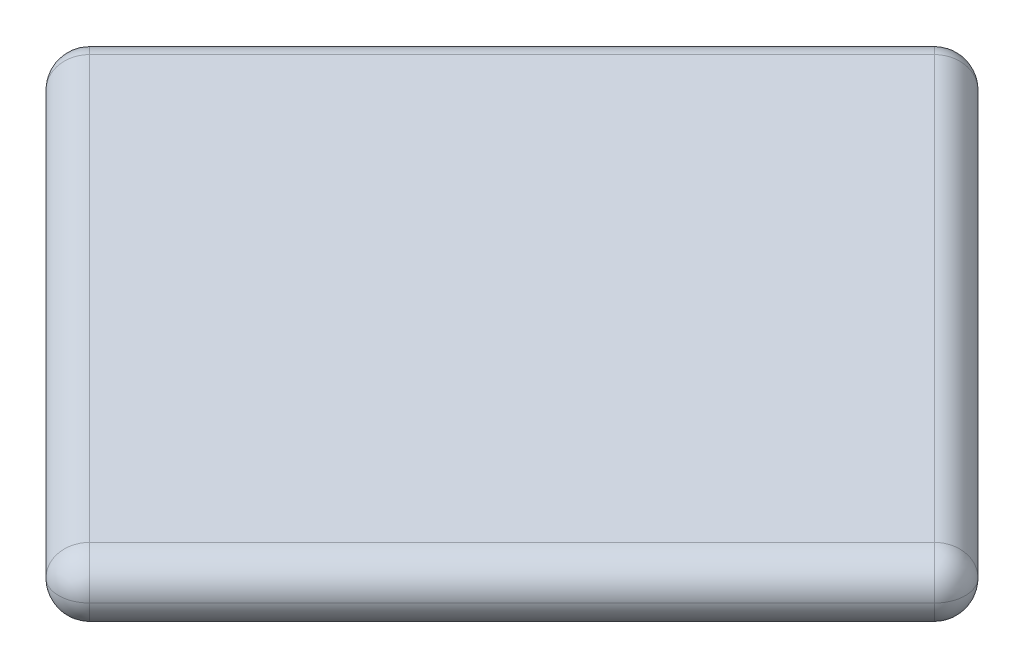
from build123d import *

# Parameters (mm, degrees)
BOSS_EXTRUDE1_DEPTH      = 20
BOSS_EXTRUDE1_DEPTH_BACK = 20
FILLET1_R                = 20


with BuildPart() as part:
    # Sketch1 → Boss-Extrude1 (new, two sides: drawn at the far end of the back side and taken through both)
    with BuildSketch(Plane(origin=(0, 0, 0), x_dir=(1, 0, 0), z_dir=(0, 1, 0)).offset(-BOSS_EXTRUDE1_DEPTH_BACK)):
        with BuildLine():
            Line((-14.142135624, 288.700864376), (-288.700864376, 14.142135624))
            ThreePointArc((-288.700864376, 14.142135624), (-294.558728753, 0), (-288.700864376, -14.142135624))
            Line((-288.700864376, -14.142135624), (-14.142135624, -288.700864376))
            ThreePointArc((-14.142135624, -288.700864376), (0, -294.558728753), (14.142135624, -288.700864376))
            Line((14.142135624, -288.700864376), (288.700864376, -14.142135624))
            ThreePointArc((288.700864376, -14.142135624), (294.558728753, 0), (288.700864376, 14.142135624))
            Line((288.700864376, 14.142135624), (14.142135624, 288.700864376))
            ThreePointArc((14.142135624, 288.700864376), (0, 294.558728753), (-14.142135624, 288.700864376))
        make_face()
    extrude(amount=BOSS_EXTRUDE1_DEPTH + BOSS_EXTRUDE1_DEPTH_BACK)

    # Fillet1
    fillet1_edges = [part.edges().sort_by_distance(p)[0] for p in [
        (151.4215, -20, 151.4215),
        (0, -20, 294.558728753),
        (-151.4215, -20, 151.4215),
        (-294.558728753, -20, 0),
        (-151.4215, -20, -151.4215),
        (0, -20, -294.558728753),
        (151.4215, -20, -151.4215),
        (294.558728753, -20, 0),
        (151.4215, 20, 151.4215),
        (0, 20, 294.558728753),
        (-151.4215, 20, 151.4215),
        (-294.558728753, 20, 0),
        (-151.4215, 20, -151.4215),
        (0, 20, -294.558728753),
        (151.4215, 20, -151.4215),
        (294.558728753, 20, 0),
    ]]
    fillet(fillet1_edges, radius=FILLET1_R - 0.0001)  # a hair under: the kernel refuses the full size


solid = part.part
